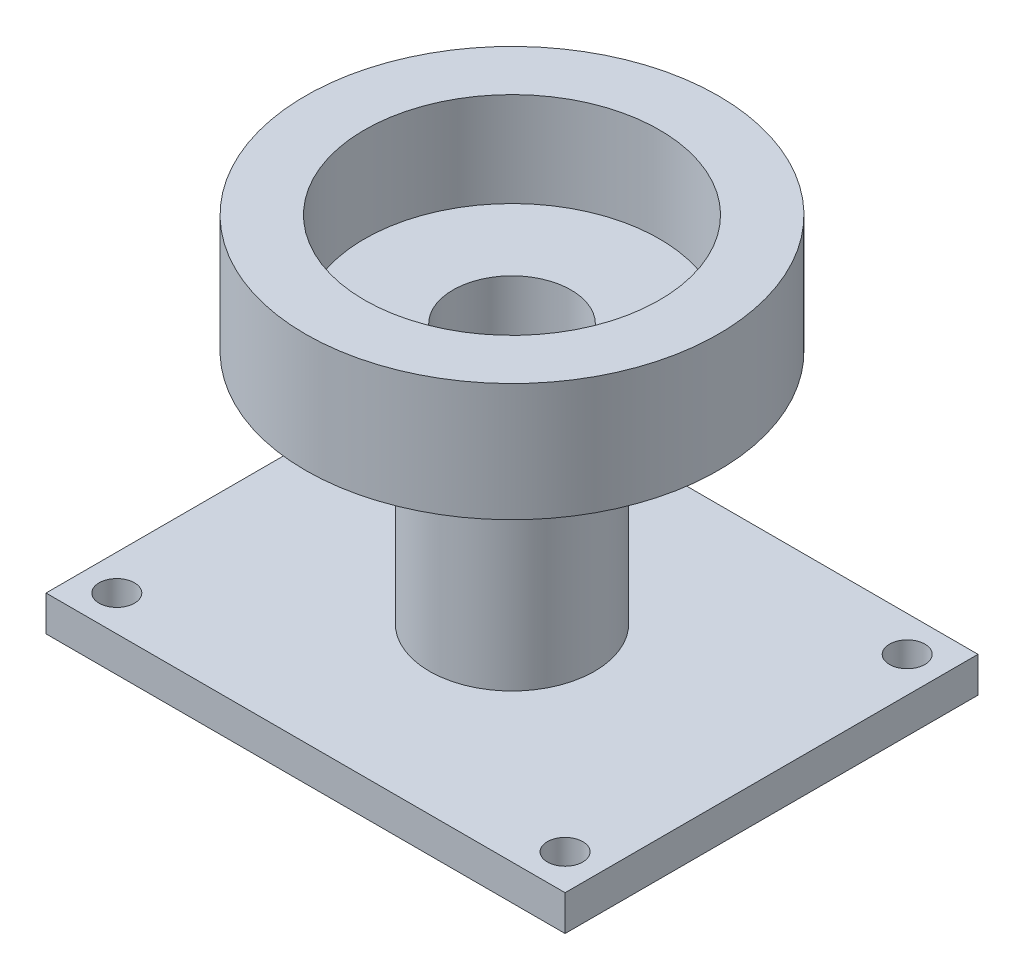
from build123d import *
from build123d.topology import SkipClean

# Parameters (mm, degrees)
SKETCH1_R           = 17.5
BOSS_EXTRUDE1_DEPTH = 10
SKETCH2_R           = 7
BOSS_EXTRUDE3_DEPTH = 20
SKETCH5_R           = 12.5
CUT_EXTRUDE1_DEPTH  = 8
SKETCH6_R           = 5
CUT_EXTRUDE2_DEPTH  = 30
SKETCH12_W          = 44
SKETCH12_H          = 35
BOSS_EXTRUDE4_DEPTH = 3
SKETCH14_R          = 1.5
CUT_EXTRUDE3_DEPTH  = 3
SKETCH15_R          = 5
CUT_EXTRUDE4_DEPTH  = 3


with BuildPart() as part:
    # Sketch1 → Boss-Extrude1 (new body)
    with BuildSketch(Plane(origin=(0, 0, 0), x_dir=(1, 0, 0), z_dir=(0, 1, 0))):
        Circle(SKETCH1_R)
    extrude(amount=BOSS_EXTRUDE1_DEPTH)

    # Sketch2 → Boss-Extrude3 (add)
    with BuildSketch(Plane(origin=(0, 0, 0), x_dir=(-1, 0, 0), z_dir=(0, -1, 0))):
        Circle(SKETCH2_R)
    extrude(amount=BOSS_EXTRUDE3_DEPTH)

    # Sketch5 → Cut-Extrude1 (cut)
    with BuildSketch(Plane(origin=(0, 10, 0), x_dir=(1, 0, 0), z_dir=(0, 1, 0))):
        Circle(SKETCH5_R)
    extrude(amount=-CUT_EXTRUDE1_DEPTH, mode=Mode.SUBTRACT)

    # Sketch6 → Cut-Extrude2 (cut)
    with BuildSketch(Plane(origin=(0, 2, 0), x_dir=(1, 0, 0), z_dir=(0, 1, 0))):
        Circle(SKETCH6_R)
    extrude(amount=-CUT_EXTRUDE2_DEPTH, mode=Mode.SUBTRACT)

    # Sketch12 → Boss-Extrude4 (add)
    with BuildSketch(Plane(origin=(0, -20, 0), x_dir=(-1, 0, 0), z_dir=(0, -1, 0))):
        Rectangle(SKETCH12_W, SKETCH12_H)
    extrude(amount=BOSS_EXTRUDE4_DEPTH)

    # Sketch14 → Cut-Extrude3 (cut)
    with BuildSketch(Plane(origin=(0, -20, 0), x_dir=(-1, 0, 0), z_dir=(0, -1, 0))):
        with Locations((-19, -14.5)):
            Circle(SKETCH14_R)
        with Locations((19, -14.5)):
            Circle(SKETCH14_R)
        with Locations((19, 14.5)):
            Circle(SKETCH14_R)
        with Locations((-19, 14.5)):
            Circle(SKETCH14_R)
    extrude(amount=CUT_EXTRUDE3_DEPTH, mode=Mode.SUBTRACT)

    # Sketch15 → Cut-Extrude4 (cut)
    with SkipClean():  # the faces are left unmerged after this step: merging them gives an invalid solid
        with BuildSketch(Plane(origin=(0, -20, 0), x_dir=(-1, 0, 0), z_dir=(0, -1, 0))):
            Circle(SKETCH15_R)
        extrude(amount=CUT_EXTRUDE4_DEPTH, mode=Mode.SUBTRACT)


solid = part.part
